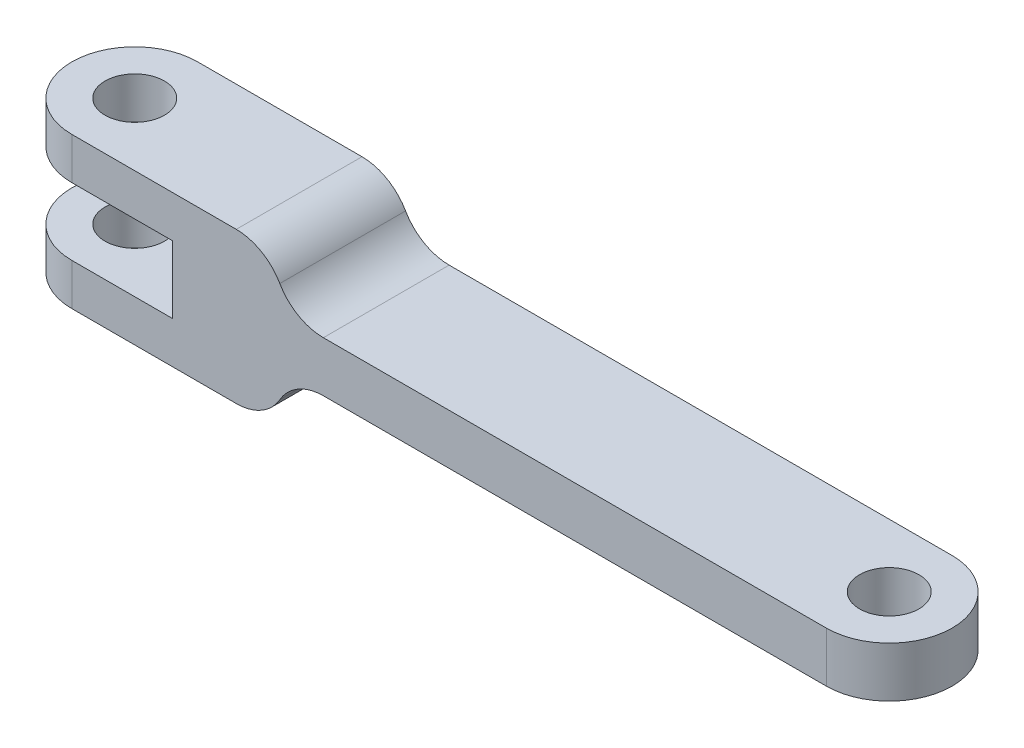
from build123d import *

# Parameters (mm, degrees)
SKETCH1_R               = 1.5
BOSS_EXTRUDE1_DEPTH     = 7.62
CUT_EXTRUDE1_DEPTH      = 1.7
CUT_EXTRUDE1_DEPTH_BACK = 1.7
SKETCH2_R               = 1.5
SKETCH3_W               = 34.821950375
SKETCH3_H               = 10.205546921
CUT_EXTRUDE2_DEPTH      = 2.54
FILLET1_R               = 2.54
FILLET2_R               = 2.54


with BuildPart() as part:
    # Sketch1 → Boss-Extrude1 (new body)
    with BuildSketch(Plane(origin=(0, 0, 0), x_dir=(1, 0, 0), z_dir=(0, 1, 0))):
        with BuildLine():
            ThreePointArc((0, 3.175), (-3.175, 0), (0, -3.175))
            Line((0, -3.175), (38.1, -3.175))
            ThreePointArc((38.1, -3.175), (41.275, 0), (38.1, 3.175))
            Line((38.1, 3.175), (0, 3.175))
        make_face()
        with Locations(Location((0, 0, 0), (0, 0, 90))):
            Circle(SKETCH1_R, mode=Mode.SUBTRACT)
        with Locations(Location((38.1, 0, 0), (0, 0, 90))):
            Circle(SKETCH1_R, mode=Mode.SUBTRACT)
    extrude(amount=BOSS_EXTRUDE1_DEPTH)

    # Sketch2 → Cut-Extrude1 (cut, two sides: drawn at the far end of the back side and taken through both)
    with BuildSketch(Plane(origin=(0, 3.81, 0), x_dir=(1, 0, 0), z_dir=(0, 1, 0)).offset(-CUT_EXTRUDE1_DEPTH_BACK)):
        with BuildLine():
            Line((0, 3.175), (5.08, 3.175))
            Line((5.08, 3.175), (5.08, -3.175))
            Line((5.08, -3.175), (0, -3.175))
            ThreePointArc((0, -3.175), (-3.175, 0), (0, 3.175))
        make_face()
        with Locations(Location((0, 0, 0), (0, 0, 90))):
            Circle(SKETCH2_R, mode=Mode.SUBTRACT)
    extrude(amount=CUT_EXTRUDE1_DEPTH + CUT_EXTRUDE1_DEPTH_BACK, mode=Mode.SUBTRACT)

    # Sketch3 → Cut-Extrude2 (cut)
    with BuildSketch(Plane(origin=(0, 7.62, 0), x_dir=(1, 0, 0), z_dir=(0, 1, 0))):
        with Locations((27.570975188, -1.92777346)):
            Rectangle(SKETCH3_W, SKETCH3_H)
    cut_extrude2 = extrude(amount=-CUT_EXTRUDE2_DEPTH, mode=Mode.SUBTRACT)

    # Mirror1: Cut-Extrude2 across plane
    add(cut_extrude2.mirror(Plane.ZX.offset(3.81)), mode=Mode.SUBTRACT)

    # Fillet1
    fillet1_edges = [part.edges().sort_by_distance(p)[0] for p in [
        (10.16, 5.08, 0),
        (10.16, 2.54, 0),
    ]]
    fillet(fillet1_edges, radius=FILLET1_R - 0.0001)  # a hair under: the kernel refuses the full size

    # Fillet2
    fillet2_edges = [part.edges().sort_by_distance(p)[0] for p in [
        (10.16, 7.62, 0),
        (10.16, 0, 0),
    ]]
    fillet(fillet2_edges, radius=FILLET2_R)


solid = part.part
